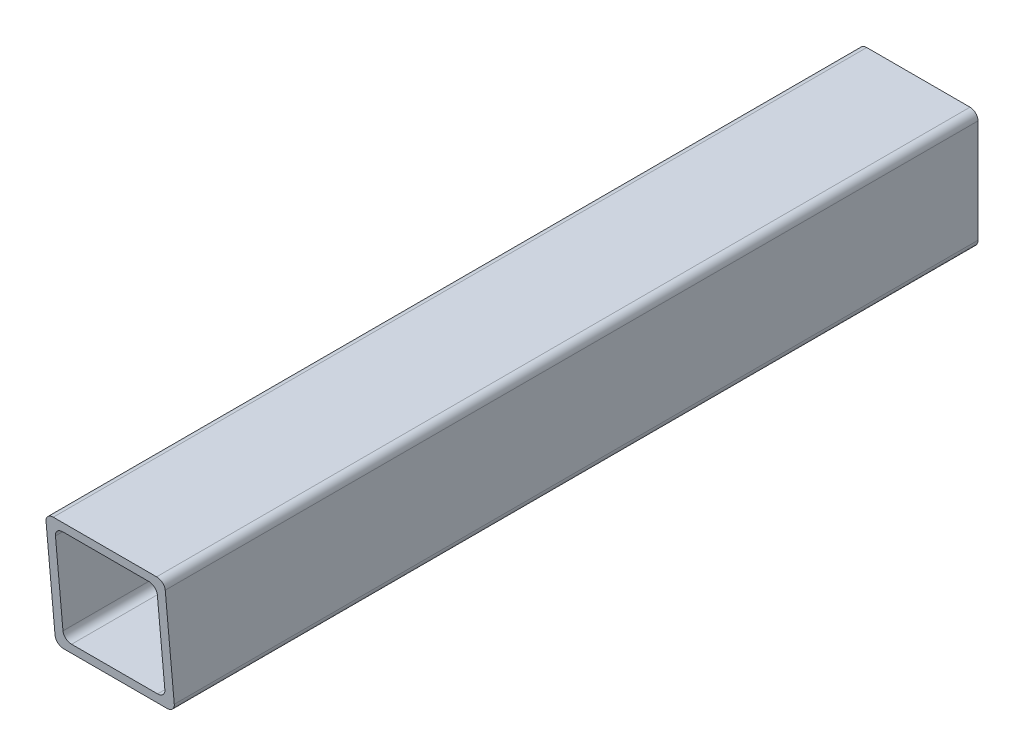
from build123d import *

# Parameters (mm, degrees)
BOSS_EXTRUDE1_DEPTH = 260
CUT_EXTRUDE1_DEPTH  = 266.524424489


with BuildPart() as part:
    # Sketch1 → Boss-Extrude1 (new body)
    with BuildSketch(Plane.XY):
        with BuildLine():
            Line((2.54, 0), (35.56, 0))
            ThreePointArc((35.56, 0), (37.356051224, -0.743948776), (38.1, -2.54))
            Line((38.1, -2.54), (38.1, -35.56))
            ThreePointArc((38.1, -35.56), (37.356051224, -37.356051224), (35.56, -38.1))
            Line((35.56, -38.1), (2.54, -38.1))
            ThreePointArc((2.54, -38.1), (0.743948776, -37.356051224), (0, -35.56))
            Line((0, -35.56), (0, -2.54))
            ThreePointArc((0, -2.54), (0.743948776, -0.743948776), (2.54, 0))
        make_face()
        with BuildLine():
            Line((5.3086, -2.7686), (32.7914, -2.7686))
            ThreePointArc((32.7914, -2.7686), (34.587451224, -3.512548776), (35.3314, -5.3086))
            Line((35.3314, -5.3086), (35.3314, -32.7914))
            ThreePointArc((35.3314, -32.7914), (34.587451224, -34.587451224), (32.7914, -35.3314))
            Line((32.7914, -35.3314), (5.3086, -35.3314))
            ThreePointArc((5.3086, -35.3314), (3.512548776, -34.587451224), (2.7686, -32.7914))
            Line((2.7686, -32.7914), (2.7686, -5.3086))
            ThreePointArc((2.7686, -5.3086), (3.512548776, -3.512548776), (5.3086, -2.7686))
        make_face(mode=Mode.SUBTRACT)
    extrude(amount=BOSS_EXTRUDE1_DEPTH)

    # Sketch2 → Cut-Extrude1 (cut, through all)
    with BuildSketch(Plane(origin=(38.1, 0, 0), x_dir=(0, 0, -1), z_dir=(1, 0, 0))):
        Polygon((-260, 0), (-256.66668192, -38.1), (-260, -38.1), align=None)
    extrude(amount=-CUT_EXTRUDE1_DEPTH, mode=Mode.SUBTRACT)


solid = part.part
